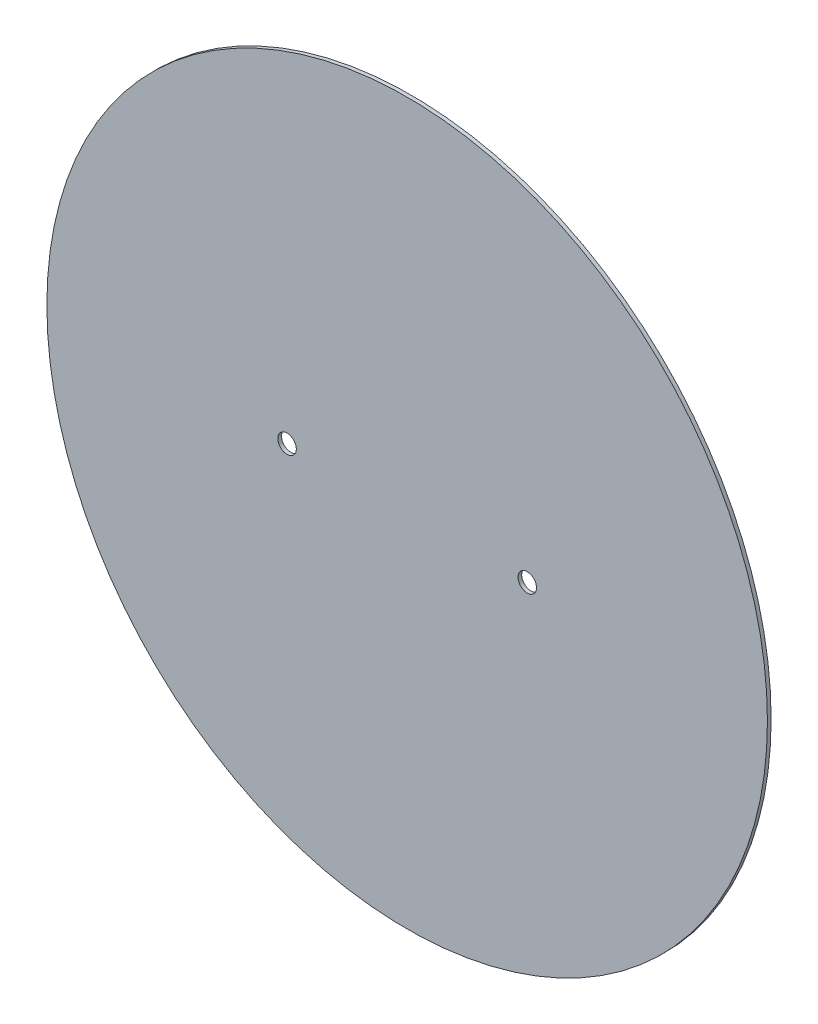
from build123d import *

# Parameters (mm, degrees)
ESBO_O1_R             = 97.5
FLANGE_BASE1_DEPTH    = 1
ESBO_O6_R             = 2.5
CORTE_EXTRUS_O1_DEPTH = 138.889448472


# Sheet-metal steps are written as plain solids
with BuildPart() as part:
    # Esboço1 → Flange-base1 (new body)
    with BuildSketch(Plane.XY):
        Circle(ESBO_O1_R)
    extrude(amount=-FLANGE_BASE1_DEPTH)

    # Esboço6 → Corte-extrusão1 (cut, through all)
    with BuildSketch(Plane(origin=(0, 0, -1), x_dir=(-1, 0, 0), z_dir=(0, 0, -1))):
        with Locations((-32.5, 0)):
            Circle(ESBO_O6_R)
        with Locations((32.5, 0)):
            Circle(ESBO_O6_R)
    extrude(amount=-CORTE_EXTRUS_O1_DEPTH, mode=Mode.SUBTRACT)


solid = part.part
